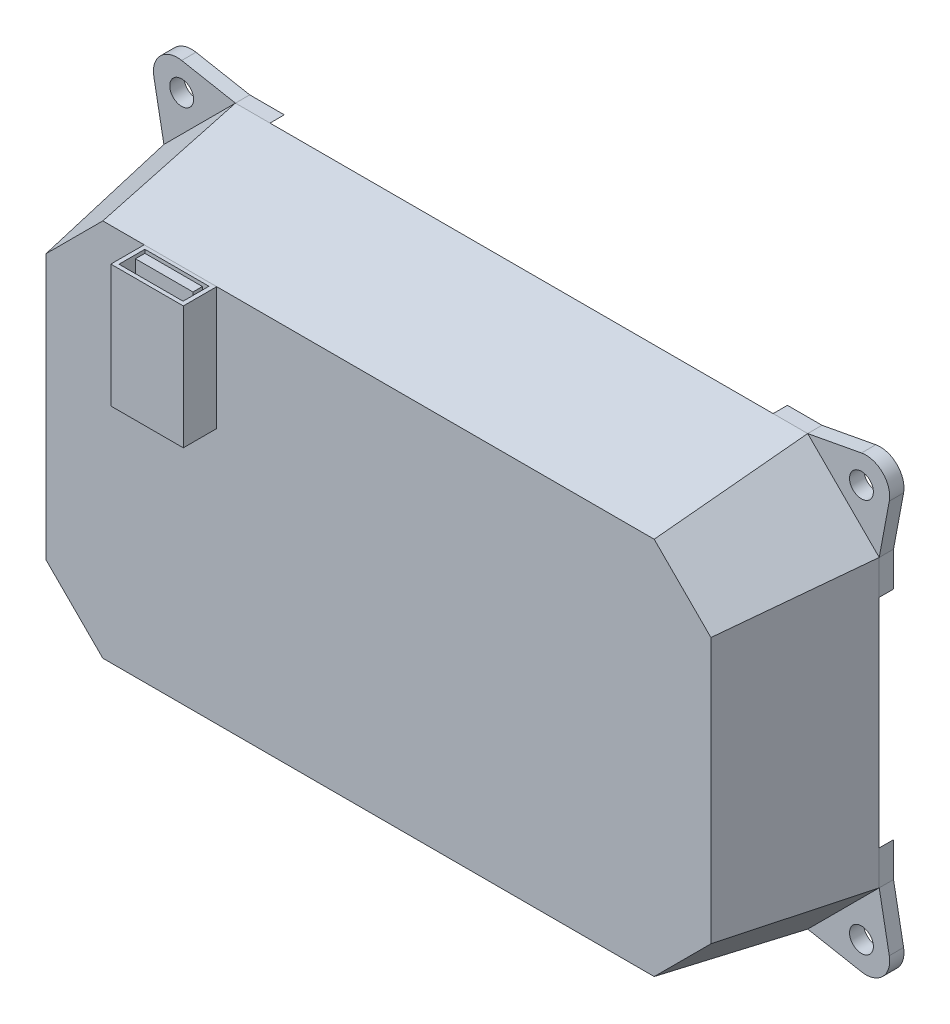
from build123d import *

# Parameters (mm, degrees)
BOSS_EXTRUDE1_DEPTH     = 30
BOSS_EXTRUDE1_TAPER     = 10
SHELL1_T                = -5
SKETCH6_W               = 15.197518051
SKETCH6_H               = 25.772318446
BOSS_EXTRUDE4_DEPTH     = 7
SKETCH7_W               = 13.433844537
SKETCH7_H               = 5.428745395
SKETCH7_W_2             = 12.053655029
SKETCH7_H_2             = 1.978271627
CUT_EXTRUDE2_DEPTH      = 17
BOSS_EXTRUDE5_OUTLINE_R = 2.499999953
BOSS_EXTRUDE5_DEPTH     = 3


# Read off the part's stored shape, not the designer's step: Boss-Extrude5
with BuildPart() as part:
    # Sketch1 → Boss-Extrude1 (new body)
    with BuildSketch(Plane.XY):
        Polygon((-100, 10.531931481), (-100, -49.468068519), (-85, -64.468068519), (35, -64.468068519), (50, -49.468068519), (50, 10.531931481), (35, 25.531931481), (-85, 25.531931481), align=None)
    extrude(amount=BOSS_EXTRUDE1_DEPTH, taper=BOSS_EXTRUDE1_TAPER)

    # Shell1
    shell1_openings = [part.faces().sort_by_distance(p)[0] for p in [
        (-25, -19.468068519, 0),
    ]]
    offset(amount=SHELL1_T, openings=shell1_openings, kind=Kind.INTERSECTION)

    # Sketch6 → Boss-Extrude4 (add)
    with BuildSketch(Plane.XY.offset(30)):
        with Locations((-66.525501272, 7.355962837)):
            Rectangle(SKETCH6_W, SKETCH6_H)
    extrude(amount=BOSS_EXTRUDE4_DEPTH)

    # Sketch7 → Cut-Extrude2 (cut)
    with BuildSketch(Plane(origin=(0, 20.24212206, 0), x_dir=(1, 0, 0), z_dir=(0, 1, 0))):
        with Locations((-66.527599538, -33.454113167)):
            Rectangle(SKETCH7_W, SKETCH7_H)
        with Locations((-66.481593222, -32.464977353)):
            Rectangle(SKETCH7_W_2, SKETCH7_H_2, mode=Mode.SUBTRACT)
    extrude(amount=-CUT_EXTRUDE2_DEPTH, mode=Mode.SUBTRACT)


with BuildPart() as body_2:
    # Boss-Extrude5 outline → Boss-Extrude5 (new body)
    with BuildSketch(Plane(origin=(0, 0, 0), x_dir=(-1, 0, 0), z_dir=(0, 0, -1))):
        with BuildLine():
            ThreePointArc((-46.274245509, 27.639965524), (-50.728742794, 26.260674275), (-52.108034043, 21.80617699))
            Line((-52.108034043, 21.80617699), (-50, 10.531931481))
            Line((-50, 10.531931481), (-50, 3.284129796))
            Line((-50, 3.284129796), (-44.922866941, 8.361262855))
            Line((-44.922866941, 8.361262855), (-44.922866941, 8.42891411))
            Line((-44.922866941, 8.42891411), (-32.896982629, 20.454798422))
            Line((-32.896982629, 20.454798422), (-32.829331374, 20.454798422))
            Line((-32.829331374, 20.454798422), (-27.752198315, 25.531931481))
            Line((-27.752198315, 25.531931481), (-35, 25.531931481))
            Line((-35, 25.531931481), (-46.274245509, 27.639965524))
        make_face()
        with Locations((-46.274245509, 21.80617699)):
            Circle(BOSS_EXTRUDE5_OUTLINE_R, mode=Mode.SUBTRACT)
    extrude(amount=BOSS_EXTRUDE5_DEPTH)


with BuildPart() as body_3:
    # Mirror6: mirrored copy
    add(body_2.part.mirror(Plane(origin=(0, -19.468068519, 0), x_dir=(0, 0, 1), z_dir=(0, -1, 0))))


with BuildPart() as body_4:
    # Mirror7: mirrored copy
    add(body_3.part.mirror(Plane(origin=(-25, 0, 0), x_dir=(0, 0, 1), z_dir=(1, 0, 0))))


with BuildPart() as body_5:
    # Mirror7 2: mirrored copy
    add(body_2.part.mirror(Plane(origin=(-25, 0, 0), x_dir=(0, 0, 1), z_dir=(1, 0, 0))))


solid = Compound([part.part, body_2.part, body_3.part, body_4.part, body_5.part])
